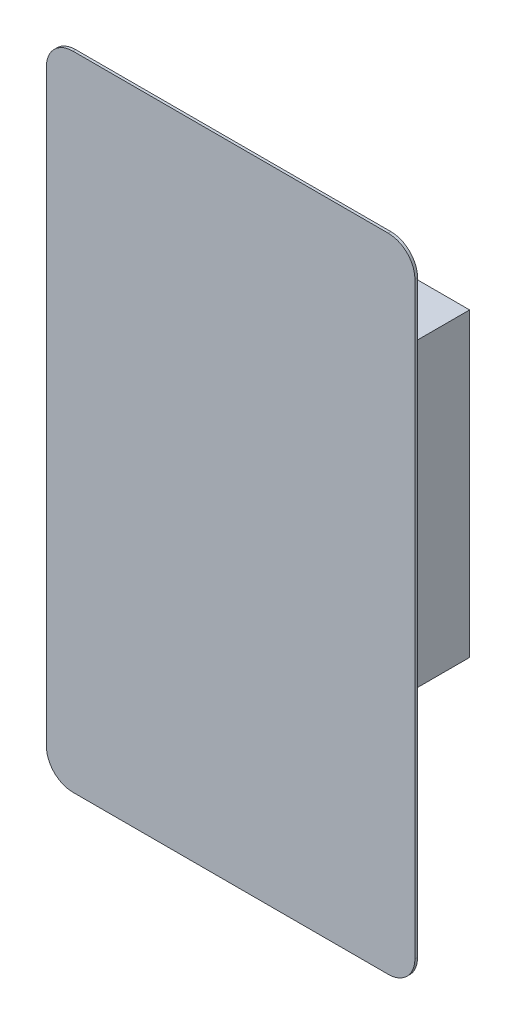
from build123d import *

# Parameters (mm, degrees)
BOSS_EXTRUDE1_DEPTH = 0.8
SKETCH2_W           = 100.7
SKETCH2_H           = 166.5
BOSS_EXTRUDE2_DEPTH = 5.3
SKETCH3_W           = 7.8
SKETCH3_H           = 15
SKETCH3_R           = 1.5
BOSS_EXTRUDE3_DEPTH = 2.6
SKETCH4_W           = 58.5
SKETCH4_H           = 90.5
BOSS_EXTRUDE4_DEPTH = 34
CHAMFER1_SIZE       = 3


with BuildPart() as part:
    # Sketch1 → Boss-Extrude1 (new body)
    with BuildSketch(Plane.XY):
        with BuildLine():
            Line((47.4, -96.5), (-47.4, -96.5))
            ThreePointArc((-47.4, -96.5), (-53.056854249, -94.156854249), (-55.4, -88.5))
            Line((-55.4, -88.5), (-55.4, 88.5))
            ThreePointArc((-55.4, 88.5), (-53.056854249, 94.156854249), (-47.4, 96.5))
            Line((-47.4, 96.5), (47.4, 96.5))
            ThreePointArc((47.4, 96.5), (53.056854249, 94.156854249), (55.4, 88.5))
            Line((55.4, 88.5), (55.4, -88.5))
            ThreePointArc((55.4, -88.5), (53.056854249, -94.156854249), (47.4, -96.5))
        make_face()
    extrude(amount=-BOSS_EXTRUDE1_DEPTH)

    # Sketch2 → Boss-Extrude2 (add)
    with BuildSketch(Plane(origin=(0, 0, -0.8), x_dir=(-1, 0, 0), z_dir=(0, 0, -1))):
        with Locations((1.4, -1.6)):
            Rectangle(SKETCH2_W, SKETCH2_H)
    extrude(amount=BOSS_EXTRUDE2_DEPTH)

    # Sketch3 → Boss-Extrude3 (add)
    # profile 1 of 4: a face of its own
    with BuildSketch(Plane(origin=(0, 0, -6.1), x_dir=(-1, 0, 0), z_dir=(0, 0, -1))):
        with Locations((-34.05, 61.65)):
            Rectangle(SKETCH3_W, SKETCH3_H)
        with Locations((-34.05, 61.65)):
            Circle(SKETCH3_R, mode=Mode.SUBTRACT)
    # profile 2 of 4: a face of its own
    with BuildSketch(Plane(origin=(0, 0, -6.1), x_dir=(-1, 0, 0), z_dir=(0, 0, -1))):
        with Locations((31.65, 61.65)):
            Rectangle(SKETCH3_W, SKETCH3_H)
        with Locations((31.65, 61.65)):
            Circle(SKETCH3_R, mode=Mode.SUBTRACT)
    # profile 3 of 4: a face of its own
    with BuildSketch(Plane(origin=(0, 0, -6.1), x_dir=(-1, 0, 0), z_dir=(0, 0, -1))):
        with Locations((-34.05, -64.55)):
            Rectangle(SKETCH3_W, SKETCH3_H)
        with Locations((-34.05, -64.55)):
            Circle(SKETCH3_R, mode=Mode.SUBTRACT)
    # profile 4 of 4: a face of its own
    with BuildSketch(Plane(origin=(0, 0, -6.1), x_dir=(-1, 0, 0), z_dir=(0, 0, -1))):
        with Locations((31.65, -64.55)):
            Rectangle(SKETCH3_W, SKETCH3_H)
        with Locations((31.65, -64.55)):
            Circle(SKETCH3_R, mode=Mode.SUBTRACT)
    extrude(amount=BOSS_EXTRUDE3_DEPTH)

    # Sketch4 → Boss-Extrude4 (add)
    with BuildSketch(Plane(origin=(0, 0, -6.1), x_dir=(-1, 0, 0), z_dir=(0, 0, -1))):
        with Locations((-2.5, 3.4)):
            Rectangle(SKETCH4_W, SKETCH4_H)
    extrude(amount=BOSS_EXTRUDE4_DEPTH)

    # Chamfer1
    # the kernel refuses this chamfer: 3 mm, written as the material it takes off along each edge
    with BuildSketch(Plane(origin=(-20.034951036, -72.05, -8.7), x_dir=(0, -0.027495876610586775, 0.9996219169112968), z_dir=(-1, 0, 0))) as chamfer1_piece_1_section:
        Polygon((CHAMFER1_SIZE * 0.999621916911, CHAMFER1_SIZE * 0.0274958766106), (-CHAMFER1_SIZE * 0.0274958766106, CHAMFER1_SIZE * 0.999621916911), (0, 0), align=None)
    chamfer1_piece_1 = extrude(amount=23.230097928, mode=Mode.PRIVATE)
    chamfer1_piece_1 = split(chamfer1_piece_1, bisect_by=Plane(origin=(-31.65, -71.03377063, -6.1), z_dir=(0, 0, -1)), keep=Keep.TOP, mode=Mode.PRIVATE)
    add(chamfer1_piece_1, mode=Mode.SUBTRACT)
    with BuildSketch(Plane(origin=(-43.265048964, -57.05, -8.7), x_dir=(0, 0.027495876610586775, 0.9996219169112968), z_dir=(1, 0, 0))) as chamfer1_piece_2_section:
        Polygon((CHAMFER1_SIZE * 0.999621916911, CHAMFER1_SIZE * 0.0274958766106), (-CHAMFER1_SIZE * 0.0274958766106, CHAMFER1_SIZE * 0.999621916911), (0, 0), align=None)
    chamfer1_piece_2 = extrude(amount=23.230097928, mode=Mode.PRIVATE)
    chamfer1_piece_2 = split(chamfer1_piece_2, bisect_by=Plane(origin=(-31.65, -58.06622937, -6.1), z_dir=(0, 0, -1)), keep=Keep.TOP, mode=Mode.PRIVATE)
    add(chamfer1_piece_2, mode=Mode.SUBTRACT)
    with BuildSketch(Plane(origin=(22.434951036, -72.05, -8.7), x_dir=(0, -0.027495876610586775, 0.9996219169112968), z_dir=(1, 0, 0))) as chamfer1_piece_3_section:
        Polygon((CHAMFER1_SIZE * 0.999621916911, -CHAMFER1_SIZE * 0.0274958766106), (-CHAMFER1_SIZE * 0.0274958766106, -CHAMFER1_SIZE * 0.999621916911), (0, 0), align=None)
    chamfer1_piece_3 = extrude(amount=23.230097928, mode=Mode.PRIVATE)
    chamfer1_piece_3 = split(chamfer1_piece_3, bisect_by=Plane(origin=(34.05, -71.03377063, -6.1), z_dir=(0, 0, -1)), keep=Keep.TOP, mode=Mode.PRIVATE)
    add(chamfer1_piece_3, mode=Mode.SUBTRACT)
    with BuildSketch(Plane(origin=(45.665048964, -57.05, -8.7), x_dir=(0, 0.027495876610586775, 0.9996219169112968), z_dir=(-1, 0, 0))) as chamfer1_piece_4_section:
        Polygon((CHAMFER1_SIZE * 0.999621916911, -CHAMFER1_SIZE * 0.0274958766106), (-CHAMFER1_SIZE * 0.0274958766106, -CHAMFER1_SIZE * 0.999621916911), (0, 0), align=None)
    chamfer1_piece_4 = extrude(amount=23.230097928, mode=Mode.PRIVATE)
    chamfer1_piece_4 = split(chamfer1_piece_4, bisect_by=Plane(origin=(34.05, -58.06622937, -6.1), z_dir=(0, 0, -1)), keep=Keep.TOP, mode=Mode.PRIVATE)
    add(chamfer1_piece_4, mode=Mode.SUBTRACT)
    with BuildSketch(Plane(origin=(45.665048964, 54.15, -8.7), x_dir=(0, -0.027495876610586775, 0.9996219169112968), z_dir=(-1, 0, 0))) as chamfer1_piece_5_section:
        Polygon((CHAMFER1_SIZE * 0.999621916911, CHAMFER1_SIZE * 0.0274958766106), (-CHAMFER1_SIZE * 0.0274958766106, CHAMFER1_SIZE * 0.999621916911), (0, 0), align=None)
    chamfer1_piece_5 = extrude(amount=23.230097928, mode=Mode.PRIVATE)
    chamfer1_piece_5 = split(chamfer1_piece_5, bisect_by=Plane(origin=(34.05, 55.16622937, -6.1), z_dir=(0, 0, -1)), keep=Keep.TOP, mode=Mode.PRIVATE)
    add(chamfer1_piece_5, mode=Mode.SUBTRACT)
    with BuildSketch(Plane(origin=(22.434951036, 69.15, -8.7), x_dir=(0, 0.027495876610586775, 0.9996219169112968), z_dir=(1, 0, 0))) as chamfer1_piece_6_section:
        Polygon((CHAMFER1_SIZE * 0.999621916911, CHAMFER1_SIZE * 0.0274958766106), (-CHAMFER1_SIZE * 0.0274958766106, CHAMFER1_SIZE * 0.999621916911), (0, 0), align=None)
    chamfer1_piece_6 = extrude(amount=23.230097928, mode=Mode.PRIVATE)
    chamfer1_piece_6 = split(chamfer1_piece_6, bisect_by=Plane(origin=(34.05, 68.13377063, -6.1), z_dir=(0, 0, -1)), keep=Keep.TOP, mode=Mode.PRIVATE)
    add(chamfer1_piece_6, mode=Mode.SUBTRACT)
    with BuildSketch(Plane(origin=(-43.265048964, 54.15, -8.7), x_dir=(0, -0.027495876610586775, 0.9996219169112968), z_dir=(1, 0, 0))) as chamfer1_piece_7_section:
        Polygon((CHAMFER1_SIZE * 0.999621916911, -CHAMFER1_SIZE * 0.0274958766106), (-CHAMFER1_SIZE * 0.0274958766106, -CHAMFER1_SIZE * 0.999621916911), (0, 0), align=None)
    chamfer1_piece_7 = extrude(amount=23.230097928, mode=Mode.PRIVATE)
    chamfer1_piece_7 = split(chamfer1_piece_7, bisect_by=Plane(origin=(-31.65, 55.16622937, -6.1), z_dir=(0, 0, -1)), keep=Keep.TOP, mode=Mode.PRIVATE)
    add(chamfer1_piece_7, mode=Mode.SUBTRACT)
    with BuildSketch(Plane(origin=(-20.034951036, 69.15, -8.7), x_dir=(0, 0.027495876610586775, 0.9996219169112968), z_dir=(-1, 0, 0))) as chamfer1_piece_8_section:
        Polygon((CHAMFER1_SIZE * 0.999621916911, -CHAMFER1_SIZE * 0.0274958766106), (-CHAMFER1_SIZE * 0.0274958766106, -CHAMFER1_SIZE * 0.999621916911), (0, 0), align=None)
    chamfer1_piece_8 = extrude(amount=23.230097928, mode=Mode.PRIVATE)
    chamfer1_piece_8 = split(chamfer1_piece_8, bisect_by=Plane(origin=(-31.65, 68.13377063, -6.1), z_dir=(0, 0, -1)), keep=Keep.TOP, mode=Mode.PRIVATE)
    add(chamfer1_piece_8, mode=Mode.SUBTRACT)


solid = part.part
